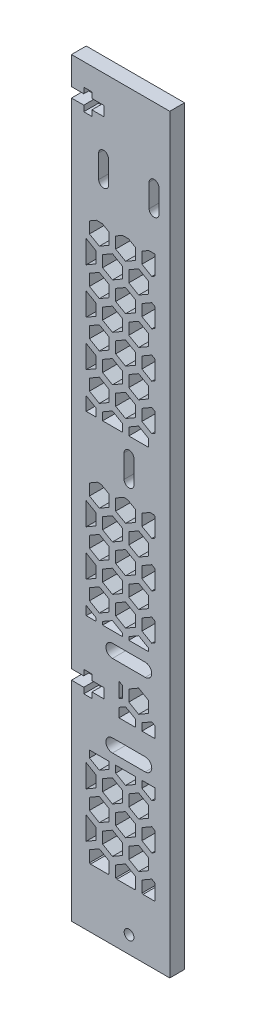
from build123d import *

# Parameters (mm, degrees)
SKETCH1_W           = 25
SKETCH1_H           = 229.0607495
SKETCH1_R           = 1.5
BOSS_EXTRUDE1_DEPTH = 4.5
CUT_EXTRUDE1_DEPTH  = 118.313497814
CUT_EXTRUDE2_DEPTH  = 118.313497814
SKETCH4_W           = 4.5
SKETCH4_H           = 229.0607495
BOSS_EXTRUDE2_DEPTH = 5
SKETCH5_W           = 3.75
SKETCH5_H           = 3
SKETCH5_W_2         = 2.5
SKETCH5_H_2         = 1.75
CUT_EXTRUDE3_DEPTH  = 5
CUT_EXTRUDE4_DEPTH  = 10


with BuildPart() as part:
    # Sketch1 → Boss-Extrude1 (new body)
    with BuildSketch(Plane.XY):
        with Locations((12.5, 0)):
            Rectangle(SKETCH1_W, SKETCH1_H)
        with Locations((4.8, 89.13037475)):
            Circle(SKETCH1_R, mode=Mode.SUBTRACT)
        with Locations((20.2, 89.13037475)):
            Circle(SKETCH1_R, mode=Mode.SUBTRACT)
        with Locations((12.55876, 13.772227202)):
            Circle(SKETCH1_R, mode=Mode.SUBTRACT)
        with BuildLine():
            add(Edge.make_bspline(
                [(11.075, -109.328089672), (11.075, -112.328089671), (14.075, -112.328089671), (14.075, -109.328089672), (14.075, -106.328089673), (11.075, -106.328089673), (11.075, -109.328089672)],
                knots=[0, 0, 0, 0, 0.5, 0.5, 0.5, 1, 1, 1, 1], degree=3, weights=[1, 0.333333333, 0.333333333, 1, 0.333333333, 0.333333333, 1]))
        make_face(mode=Mode.SUBTRACT)
    extrude(amount=BOSS_EXTRUDE1_DEPTH)

    # Sketch2 → Cut-Extrude1 (cut, through all)
    with BuildSketch(Plane.XY.offset(4.5)):
        with BuildLine():
            Line((7.5, -34.813160449), (17.5, -34.813160449))
            ThreePointArc((17.5, -34.813160449), (19.5, -36.813160449), (17.5, -38.813160449))
            Line((17.5, -38.813160449), (7.5, -38.813160449))
            ThreePointArc((7.5, -38.813160449), (5.5, -36.813160449), (7.5, -34.813160449))
        make_face()
        with BuildLine():
            Line((7.5, -63.813160449), (17.5, -63.813160449))
            ThreePointArc((17.5, -63.813160449), (19.5, -61.813160449), (17.5, -59.813160449))
            Line((17.5, -59.813160449), (7.5, -59.813160449))
            ThreePointArc((7.5, -59.813160449), (5.5, -61.813160449), (7.5, -63.813160449))
        make_face()
    extrude(amount=-CUT_EXTRUDE1_DEPTH, mode=Mode.SUBTRACT)

    # Sketch3 → Cut-Extrude2 (cut, through all)
    with BuildSketch(Plane.XY.offset(4.5)):
        with BuildLine():
            Line((6.3, 92.63037475), (6.3, 85.63037475))
            ThreePointArc((6.3, 85.63037475), (4.8, 84.13037475), (3.3, 85.63037475))
            Line((3.3, 85.63037475), (3.3, 92.63037475))
            ThreePointArc((3.3, 92.63037475), (4.8, 94.13037475), (6.3, 92.63037475))
        make_face()
        with BuildLine():
            Line((18.7, 92.63037475), (18.7, 85.63037475))
            ThreePointArc((18.7, 85.63037475), (20.2, 84.13037475), (21.7, 85.63037475))
            Line((21.7, 85.63037475), (21.7, 92.63037475))
            ThreePointArc((21.7, 92.63037475), (20.2, 94.13037475), (18.7, 92.63037475))
        make_face()
        with BuildLine():
            Line((14.05876, 17.272227202), (14.05876, 10.272227202))
            ThreePointArc((14.05876, 10.272227202), (12.55876, 8.772227202), (11.05876, 10.272227202))
            Line((11.05876, 10.272227202), (11.05876, 17.272227202))
            ThreePointArc((11.05876, 17.272227202), (12.55876, 18.772227202), (14.05876, 17.272227202))
        make_face()
    extrude(amount=-CUT_EXTRUDE2_DEPTH, mode=Mode.SUBTRACT)

    # Sketch4 → Boss-Extrude2 (add)
    with BuildSketch(Plane.ZY):
        with Locations((2.25, 0)):
            Rectangle(SKETCH4_W, SKETCH4_H)
    extrude(amount=BOSS_EXTRUDE2_DEPTH)

    # Sketch5 → Cut-Extrude3 (cut)
    with BuildSketch(Plane.XY.offset(4.5)):
        with Locations((-3.125, -49.313160449)):
            Rectangle(SKETCH5_W, SKETCH5_H)
        with Locations((0, -49.313160449)):
            Rectangle(SKETCH5_W_2, SKETCH5_H)
        with Locations((0, -46.938160449)):
            Rectangle(SKETCH5_W_2, SKETCH5_H_2)
        with Locations((3.125, -49.313160449)):
            Rectangle(SKETCH5_W, SKETCH5_H)
        with Locations((0, -51.688160449)):
            Rectangle(SKETCH5_W_2, SKETCH5_H_2)
        with Locations((3.125, 104.53037475)):
            Rectangle(SKETCH5_W, SKETCH5_H)
        with Locations((0, 102.15537475)):
            Rectangle(SKETCH5_W_2, SKETCH5_H_2)
        with Locations((0, 104.53037475)):
            Rectangle(SKETCH5_W_2, SKETCH5_H)
        with Locations((-3.125, 104.53037475)):
            Rectangle(SKETCH5_W, SKETCH5_H)
        with Locations((0, 106.90537475)):
            Rectangle(SKETCH5_W_2, SKETCH5_H_2)
    extrude(amount=-CUT_EXTRUDE3_DEPTH, mode=Mode.SUBTRACT)

    # Sketch6 → Cut-Extrude4 (cut)
    with BuildSketch(Plane.XY.offset(4.5)):
        Polygon((0.828649647, -96.53037475), (6.171350353, -96.53037475), (6.5, -96.340628788), (6.5, -92.876527173), (3.5, -91.144476366), (0.5, -92.876527173), (0.5, -96.340628788), align=None)
        Polygon((8.828649647, -96.53037475), (14.171350353, -96.53037475), (14.5, -96.340628788), (14.5, -92.876527173), (11.5, -91.144476366), (8.5, -92.876527173), (8.5, -96.340628788), align=None)
        Polygon((16.828649647, -96.53037475), (20.5, -96.53037475), (20.5, -91.721826635), (19.5, -91.144476366), (16.5, -92.876527173), (16.5, -96.340628788), align=None)
        Polygon((12.5, -89.412425558), (15.5, -91.144476366), (18.5, -89.412425558), (18.5, -85.948323943), (15.5, -84.216273135), (12.5, -85.948323943), align=None)
        Polygon((4.5, -89.412425558), (7.5, -91.144476366), (10.5, -89.412425558), (10.5, -85.948323943), (7.5, -84.216273135), (4.5, -85.948323943), align=None)
        Polygon((-0.5, -84.216273135), (-0.5, -91.144476366), (2.5, -89.412425558), (2.5, -85.948323943), align=None)
        Polygon((0.5, -79.026527173), (0.5, -82.490628788), (3.5, -84.222679596), (6.5, -82.490628788), (6.5, -79.026527173), (3.5, -77.294476366), align=None)
        Polygon((8.5, -79.026527173), (8.5, -82.490628788), (11.5, -84.222679596), (14.5, -82.490628788), (14.5, -79.026527173), (11.5, -77.294476366), align=None)
        Polygon((19.5, -84.222679596), (20.5, -83.645329327), (20.5, -77.871826635), (19.5, -77.294476366), (16.5, -79.026527173), (16.5, -82.490628788), align=None)
        Polygon((12.5, -75.562425558), (15.5, -77.294476366), (18.5, -75.562425558), (18.5, -72.098323943), (15.5, -70.366273135), (12.5, -72.098323943), align=None)
        Polygon((4.5, -75.562425558), (7.5, -77.294476366), (10.5, -75.562425558), (10.5, -72.098323943), (7.5, -70.366273135), (4.5, -72.098323943), align=None)
        Polygon((-0.5, -70.366273135), (-0.5, -77.294476366), (2.5, -75.562425558), (2.5, -72.098323943), align=None)
        Polygon((6.5, -66.53037475), (0.5, -66.53037475), (0.5, -68.640628788), (3.5, -70.372679596), (6.5, -68.640628788), align=None)
        Polygon((14.5, -68.640628788), (14.5, -66.53037475), (8.5, -66.53037475), (8.5, -68.640628788), (11.5, -70.372679596), align=None)
        Polygon((19.5, -70.372679596), (20.5, -69.795329327), (20.5, -66.53037475), (16.5, -66.53037475), (16.5, -68.640628788), align=None)
        Polygon((9.5, -53.53037475), (14.5, -53.53037475), (14.5, -51.326527173), (11.5, -49.594476366), (9.5, -50.749176904), align=None)
        Polygon((16.5, -53.53037475), (20.5, -53.53037475), (20.5, -50.171826635), (19.5, -49.594476366), (16.5, -51.326527173), align=None)
        Polygon((12.5, -47.862425558), (15.5, -49.594476366), (18.5, -47.862425558), (18.5, -44.398323943), (15.5, -42.666273135), (12.5, -44.398323943), align=None)
        Polygon((9.5, -43.820973674), (9.5, -48.439775827), (10.5, -47.862425558), (10.5, -44.398323943), align=None)
        Polygon((-0.5, -31.53037475), (2.5, -31.53037475), (2.5, -30.548323943), (-0.5, -28.816273135), align=None)
        Polygon((4.5, -31.53037475), (10.5, -31.53037475), (10.5, -30.548323943), (7.5, -28.816273135), (4.5, -30.548323943), align=None)
        Polygon((12.5, -31.53037475), (18.5, -31.53037475), (18.5, -30.548323943), (15.5, -28.816273135), (12.5, -30.548323943), align=None)
        Polygon((19.5, -28.822679596), (20.5, -28.245329327), (20.5, -22.471826635), (19.5, -21.894476366), (16.5, -23.626527173), (16.5, -27.090628788), align=None)
        Polygon((8.5, -23.626527173), (8.5, -27.090628788), (11.5, -28.822679596), (14.5, -27.090628788), (14.5, -23.626527173), (11.5, -21.894476366), align=None)
        Polygon((0.5, -23.626527173), (0.5, -27.090628788), (3.5, -28.822679596), (6.5, -27.090628788), (6.5, -23.626527173), (3.5, -21.894476366), align=None)
        Polygon((-0.5, -14.966273135), (-0.5, -21.894476366), (2.5, -20.162425558), (2.5, -16.698323943), align=None)
        Polygon((4.5, -20.162425558), (7.5, -21.894476366), (10.5, -20.162425558), (10.5, -16.698323943), (7.5, -14.966273135), (4.5, -16.698323943), align=None)
        Polygon((12.5, -20.162425558), (15.5, -21.894476366), (18.5, -20.162425558), (18.5, -16.698323943), (15.5, -14.966273135), (12.5, -16.698323943), align=None)
        Polygon((0.5, -9.776527173), (0.5, -13.240628788), (3.5, -14.972679596), (6.5, -13.240628788), (6.5, -9.776527173), (3.5, -8.044476366), align=None)
        Polygon((8.5, -9.776527173), (8.5, -13.240628788), (11.5, -14.972679596), (14.5, -13.240628788), (14.5, -9.776527173), (11.5, -8.044476366), align=None)
        Polygon((19.5, -14.972679596), (20.5, -14.395329327), (20.5, -8.621826635), (19.5, -8.044476366), (16.5, -9.776527173), (16.5, -13.240628788), align=None)
        Polygon((12.5, -6.312425558), (15.5, -8.044476366), (18.5, -6.312425558), (18.5, -2.848323943), (15.5, -1.116273135), (12.5, -2.848323943), align=None)
        Polygon((4.5, -6.312425558), (7.5, -8.044476366), (10.5, -6.312425558), (10.5, -2.848323943), (7.5, -1.116273135), (4.5, -2.848323943), align=None)
        Polygon((-0.5, -1.116273135), (-0.5, -8.044476366), (2.5, -6.312425558), (2.5, -2.848323943), align=None)
        Polygon((4.081793069, 5.46962525), (2.918206931, 5.46962525), (0.5, 4.073472827), (0.5, 0.609371212), (3.5, -1.122679596), (6.5, 0.609371212), (6.5, 4.073472827), align=None)
        Polygon((14.5, 4.073472827), (12.081793069, 5.46962525), (10.918206931, 5.46962525), (8.5, 4.073472827), (8.5, 0.609371212), (11.5, -1.122679596), (14.5, 0.609371212), align=None)
        Polygon((19.5, -1.122679596), (20.5, -0.545329327), (20.5, 5.228173365), (20.081793069, 5.46962525), (18.918206931, 5.46962525), (16.5, 4.073472827), (16.5, 0.609371212), align=None)
        Polygon((-0.5, 22.46962525), (2.5, 22.46962525), (2.5, 24.851676057), (-0.5, 26.583726865), align=None)
        Polygon((4.5, 22.46962525), (10.5, 22.46962525), (10.5, 24.851676057), (7.5, 26.583726865), (4.5, 24.851676057), align=None)
        Polygon((12.5, 22.46962525), (18.5, 22.46962525), (18.5, 24.851676057), (15.5, 26.583726865), (12.5, 24.851676057), align=None)
        Polygon((19.5, 26.577320404), (20.5, 27.154670673), (20.5, 32.928173365), (19.5, 33.505523634), (16.5, 31.773472827), (16.5, 28.309371212), align=None)
        Polygon((8.5, 31.773472827), (8.5, 28.309371212), (11.5, 26.577320404), (14.5, 28.309371212), (14.5, 31.773472827), (11.5, 33.505523634), align=None)
        Polygon((0.5, 31.773472827), (0.5, 28.309371212), (3.5, 26.577320404), (6.5, 28.309371212), (6.5, 31.773472827), (3.5, 33.505523634), align=None)
        Polygon((-0.5, 40.433726865), (-0.5, 33.505523634), (2.5, 35.237574442), (2.5, 38.701676057), align=None)
        Polygon((4.5, 35.237574442), (7.5, 33.505523634), (10.5, 35.237574442), (10.5, 38.701676057), (7.5, 40.433726865), (4.5, 38.701676057), align=None)
        Polygon((12.5, 35.237574442), (15.5, 33.505523634), (18.5, 35.237574442), (18.5, 38.701676057), (15.5, 40.433726865), (12.5, 38.701676057), align=None)
        Polygon((19.5, 40.427320404), (20.5, 41.004670673), (20.5, 46.778173365), (19.5, 47.355523634), (16.5, 45.623472827), (16.5, 42.159371212), align=None)
        Polygon((8.5, 45.623472827), (8.5, 42.159371212), (11.5, 40.427320404), (14.5, 42.159371212), (14.5, 45.623472827), (11.5, 47.355523634), align=None)
        Polygon((0.5, 45.623472827), (0.5, 42.159371212), (3.5, 40.427320404), (6.5, 42.159371212), (6.5, 45.623472827), (3.5, 47.355523634), align=None)
        Polygon((-0.5, 54.283726865), (-0.5, 47.355523634), (2.5, 49.087574442), (2.5, 52.551676057), align=None)
        Polygon((4.5, 49.087574442), (7.5, 47.355523634), (10.5, 49.087574442), (10.5, 52.551676057), (7.5, 54.283726865), (4.5, 52.551676057), align=None)
        Polygon((12.5, 49.087574442), (15.5, 47.355523634), (18.5, 49.087574442), (18.5, 52.551676057), (15.5, 54.283726865), (12.5, 52.551676057), align=None)
        Polygon((19.5, 54.277320404), (20.5, 54.854670673), (20.5, 60.628173365), (19.5, 61.205523634), (16.5, 59.473472827), (16.5, 56.009371212), align=None)
        Polygon((8.5, 59.473472827), (8.5, 56.009371212), (11.5, 54.277320404), (14.5, 56.009371212), (14.5, 59.473472827), (11.5, 61.205523634), align=None)
        Polygon((0.5, 59.473472827), (0.5, 56.009371212), (3.5, 54.277320404), (6.5, 56.009371212), (6.5, 59.473472827), (3.5, 61.205523634), align=None)
        Polygon((-0.5, 68.133726865), (-0.5, 61.205523634), (2.5, 62.937574442), (2.5, 66.401676057), align=None)
        Polygon((4.5, 62.937574442), (7.5, 61.205523634), (10.5, 62.937574442), (10.5, 66.401676057), (7.5, 68.133726865), (4.5, 66.401676057), align=None)
        Polygon((12.5, 62.937574442), (15.5, 61.205523634), (18.5, 62.937574442), (18.5, 66.401676057), (15.5, 68.133726865), (12.5, 66.401676057), align=None)
        Polygon((19.5, 68.127320404), (20.5, 68.704670673), (20.5, 74.478173365), (20.409584548, 74.53037475), (18.590415452, 74.53037475), (16.5, 73.323472827), (16.5, 69.859371212), align=None)
        Polygon((12.409584548, 74.53037475), (10.590415452, 74.53037475), (8.5, 73.323472827), (8.5, 69.859371212), (11.5, 68.127320404), (14.5, 69.859371212), (14.5, 73.323472827), align=None)
        Polygon((4.409584548, 74.53037475), (2.590415452, 74.53037475), (0.5, 73.323472827), (0.5, 69.859371212), (3.5, 68.127320404), (6.5, 69.859371212), (6.5, 73.323472827), align=None)
    extrude(amount=-CUT_EXTRUDE4_DEPTH, mode=Mode.SUBTRACT)


solid = part.part
